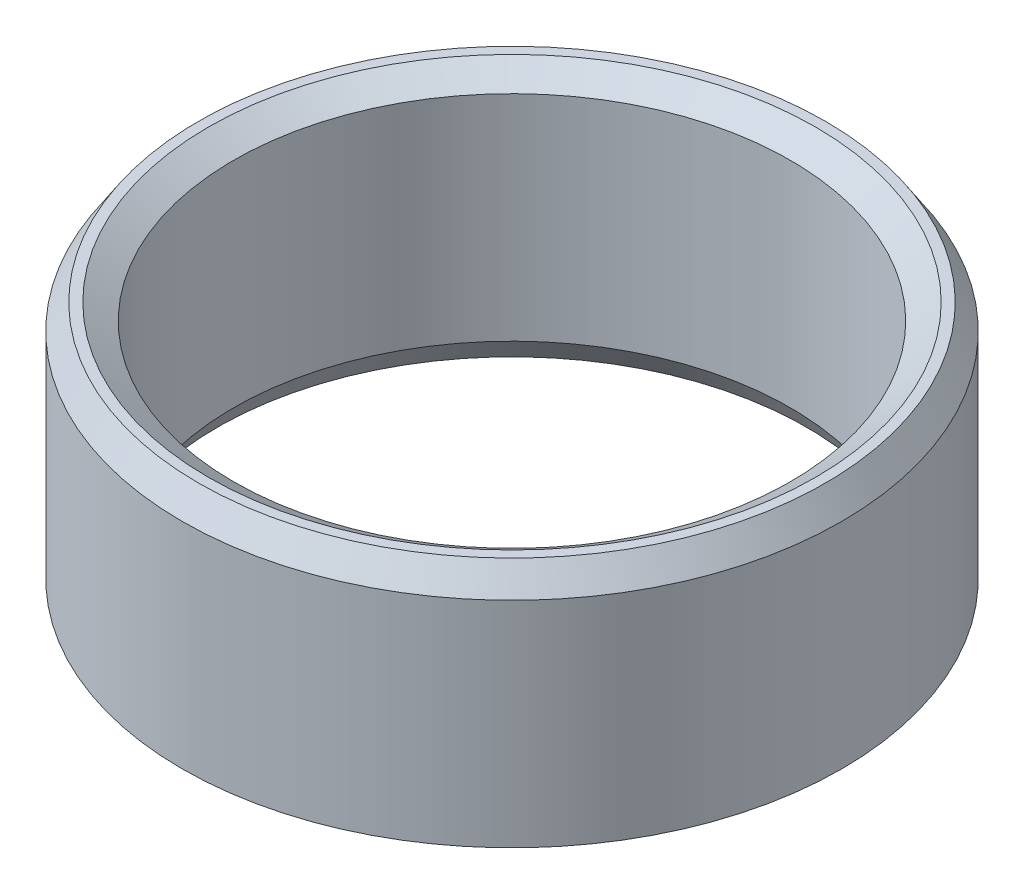
from build123d import *
from OCP.BRepFilletAPI import BRepFilletAPI_MakeChamfer

# Parameters (mm, degrees)
SKETCH1_R           = 22.5
BOSS_EXTRUDE1_DEPTH = 17.450124689
SKETCH2_R           = 19.000353155
CUT_EXTRUDE1_DEPTH  = 37.290589023
CHAMFER1_SIZE       = 1.711254432
CHAMFER1_SIZE2      = 1.111534246


with BuildPart() as part:
    # Sketch1 → Boss-Extrude1 (new body)
    with BuildSketch(Plane(origin=(0, 0, 0), x_dir=(1, 0, 0), z_dir=(0, 1, 0))):
        Circle(SKETCH1_R)
    extrude(amount=BOSS_EXTRUDE1_DEPTH)

    # Sketch2 → Cut-Extrude1 (cut, through all)
    with BuildSketch(Plane(origin=(0, 0, 0), x_dir=(1, 0, 0), z_dir=(0, 1, 0))):
        Circle(SKETCH2_R)
    extrude(amount=CUT_EXTRUDE1_DEPTH, mode=Mode.SUBTRACT)

    # Chamfer1: one chamfer whose edges measure the first distance from different faces: ONE call of the kernel's chamfer builder (chamfer() names one face for all edges)
    chamfer1_edges_1 = [part.edges().sort_by_distance(p)[0] for p in [
        (-19.000353155, 17.450124689, 0),
    ]]
    chamfer1_side_1 = [part.faces().sort_by_distance(p)[0] for p in [
        (-21.863603897, 17.450124689, 0),
    ]]
    chamfer1_edges_2 = [part.edges().sort_by_distance(p)[0] for p in [
        (-19.000353155, 0, 0),
    ]]
    chamfer1_side_2 = [part.faces().sort_by_distance(p)[0] for p in [
        (-19.000353155, 8.725062345, 0),
    ]]
    chamfer1_edges_3 = [part.edges().sort_by_distance(p)[0] for p in [
        (-22.5, 0, 0),
    ]]
    chamfer1_side_3 = [part.faces().sort_by_distance(p)[0] for p in [
        (-21.863603897, 0, 0),
    ]]
    chamfer1_edges_4 = [part.edges().sort_by_distance(p)[0] for p in [
        (-22.5, 17.450124689, 0),
    ]]
    chamfer1_side_4 = [part.faces().sort_by_distance(p)[0] for p in [
        (-22.5, 8.725062345, 0),
    ]]
    chamfer1 = BRepFilletAPI_MakeChamfer(part.part.solid().wrapped)
    for e in chamfer1_edges_1:
        chamfer1.Add(CHAMFER1_SIZE, CHAMFER1_SIZE2, e.wrapped, chamfer1_side_1[0].wrapped)  # the first distance lies on this face
    for e in chamfer1_edges_2:
        chamfer1.Add(CHAMFER1_SIZE, CHAMFER1_SIZE2, e.wrapped, chamfer1_side_2[0].wrapped)  # the first distance lies on this face
    for e in chamfer1_edges_3:
        chamfer1.Add(CHAMFER1_SIZE, CHAMFER1_SIZE2, e.wrapped, chamfer1_side_3[0].wrapped)  # the first distance lies on this face
    for e in chamfer1_edges_4:
        chamfer1.Add(CHAMFER1_SIZE, CHAMFER1_SIZE2, e.wrapped, chamfer1_side_4[0].wrapped)  # the first distance lies on this face
    add(Compound.cast(chamfer1.Shape()), mode=Mode.REPLACE)


solid = part.part
